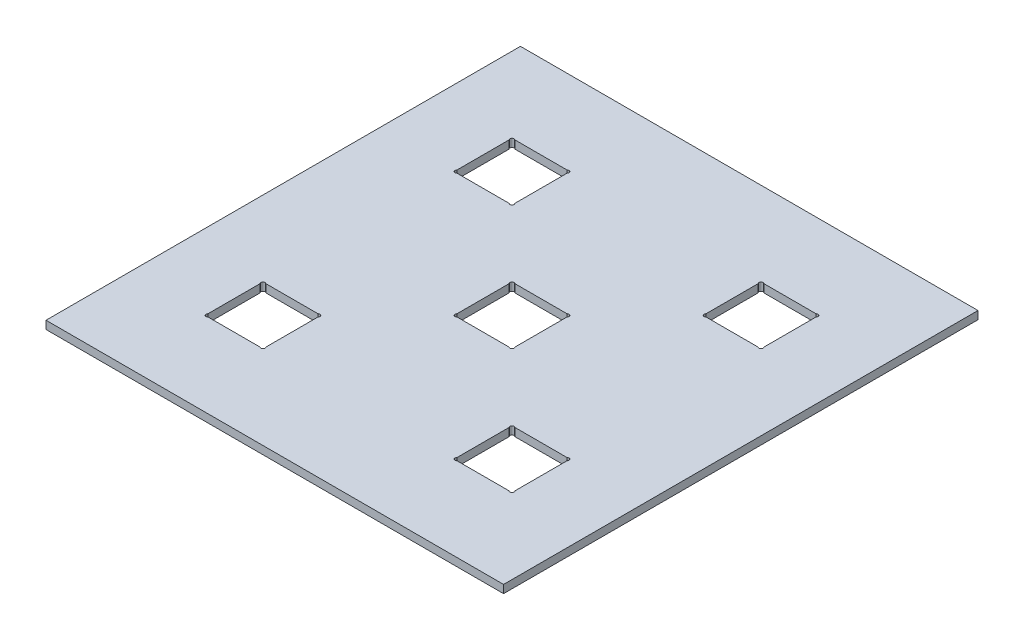
from build123d import *

# Parameters (mm, degrees)
SKETCH1_W           = 180.848
SKETCH1_H           = 187.5155
BOSS_EXTRUDE1_DEPTH = 3.175
SKETCH2_W           = 22.86
SKETCH2_H           = 22.86
CUT_EXTRUDE1_DEPTH  = 3.175
SKETCH3_R           = 0.79375
CUT_EXTRUDE2_DEPTH  = 131.296186


with BuildPart() as part:
    # Sketch1 → Boss-Extrude1 (new body)
    with BuildSketch(Plane(origin=(0, 0, 0), x_dir=(1, 0, 0), z_dir=(0, 1, 0))):
        Rectangle(SKETCH1_W, SKETCH1_H)
    extrude(amount=BOSS_EXTRUDE1_DEPTH)

    # Sketch2 → Cut-Extrude1 (cut)
    with BuildSketch(Plane(origin=(0, 3.175, 0), x_dir=(1, 0, 0), z_dir=(0, 1, 0))):
        Rectangle(SKETCH2_W, SKETCH2_H)
    cut_extrude1 = extrude(amount=-CUT_EXTRUDE1_DEPTH, mode=Mode.SUBTRACT)

    # Sketch3 → Cut-Extrude2 (cut, through all)
    with BuildSketch(Plane(origin=(0, 3.175, 0), x_dir=(1, 0, 0), z_dir=(0, 1, 0))):
        with Locations((-10.868733992, 10.868733992)):
            Circle(SKETCH3_R)
        with Locations((10.868733992, 10.868733992)):
            Circle(SKETCH3_R)
        with Locations((10.868733992, -10.868733992)):
            Circle(SKETCH3_R)
        with Locations((-10.868733992, -10.868733992)):
            Circle(SKETCH3_R)
    cut_extrude2 = extrude(amount=-CUT_EXTRUDE2_DEPTH, mode=Mode.SUBTRACT)

    # Sketch-Pattern1: Cut-Extrude1, Cut-Extrude2 at 4 more places
    with Locations((-49.2125, 0, 49.2125), (-49.2125, 0, -49.2125), (49.2125, 0, -49.2125), (49.2125, 0, 49.2125)):
        add(cut_extrude1, mode=Mode.SUBTRACT)
        add(cut_extrude2, mode=Mode.SUBTRACT)


solid = part.part
